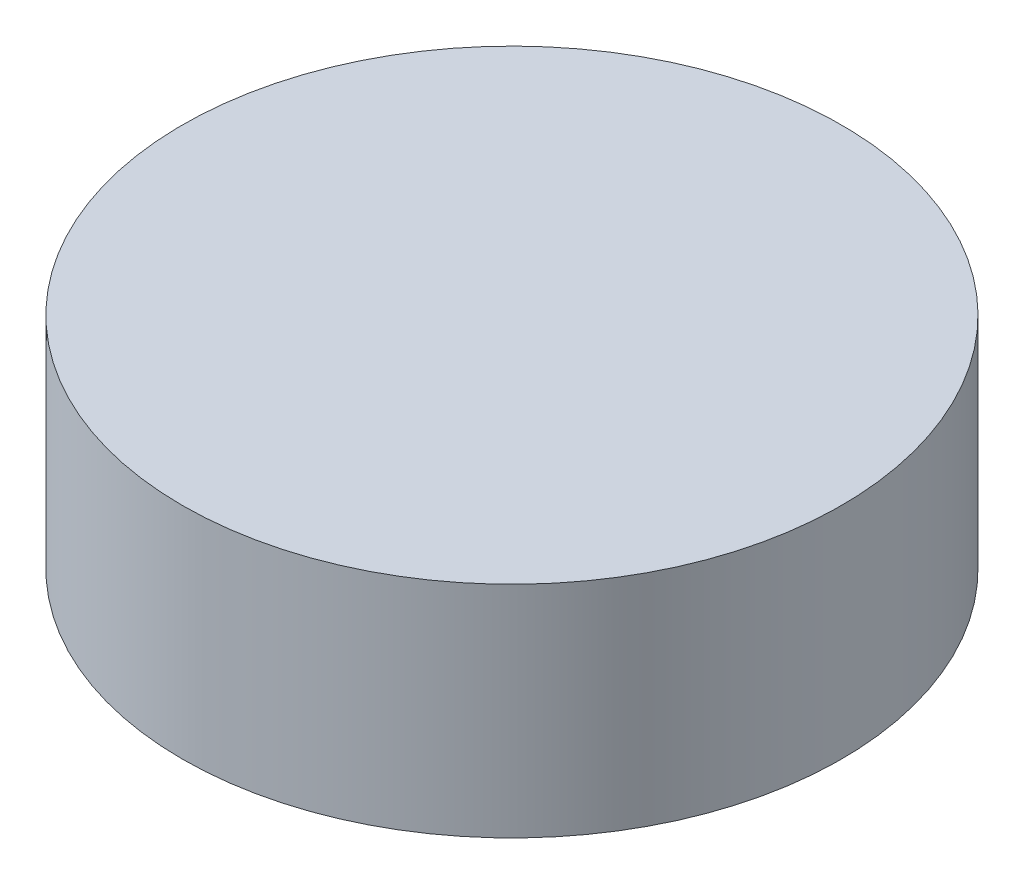
from build123d import *

# Parameters (mm, degrees)
SKETCH1_R           = 30
BOSS_EXTRUDE1_DEPTH = 10
SKETCH2_R           = 19
CUT_EXTRUDE1_DEPTH  = 15


with BuildPart() as part:
    # Sketch1 → Boss-Extrude1 (new, symmetric)
    with BuildSketch(Plane(origin=(0, 0, 0), x_dir=(1, 0, 0), z_dir=(0, 1, 0))):
        Circle(SKETCH1_R)
    extrude(amount=BOSS_EXTRUDE1_DEPTH, both=True)

    # Sketch2 → Cut-Extrude1 (cut)
    with BuildSketch(Plane.XZ.offset(10)):
        Circle(SKETCH2_R)
    extrude(amount=-CUT_EXTRUDE1_DEPTH, mode=Mode.SUBTRACT)


solid = part.part
